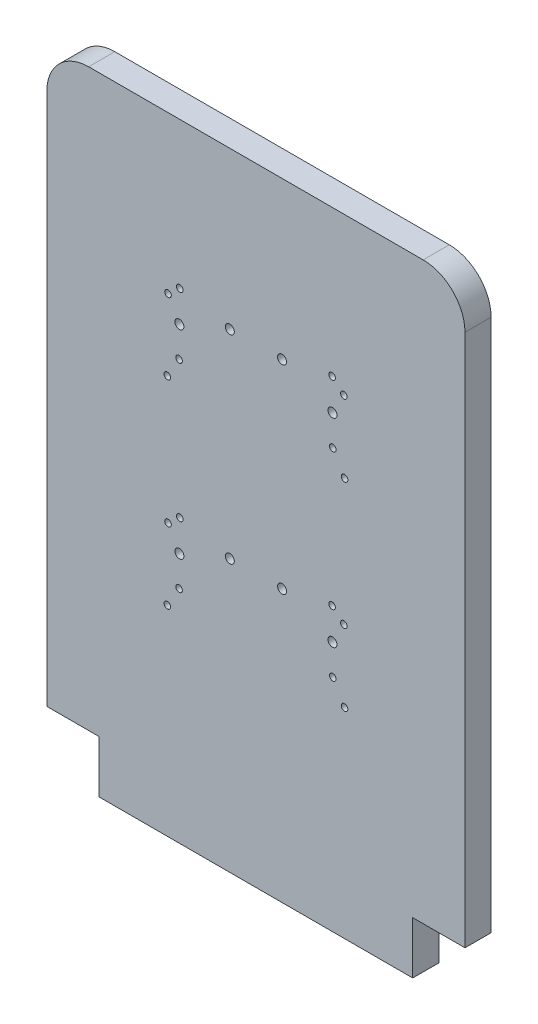
from build123d import *

# Parameters (mm, degrees)
SKETCH1_R           = 1.0922
SKETCH1_R_2         = 0.8
BOSS_EXTRUDE1_DEPTH = 6.35
FILLET1_R           = 10.16


with BuildPart() as part:
    # Sketch1 → Boss-Extrude1 (new body)
    with BuildSketch(Plane.XY):
        Polygon((88.9, 0), (101.6, 0), (101.6, 139.7), (0, 139.7), (0, 0), (12.7, 0), (12.7, -12.7), (88.9, -12.7), align=None)
        with Locations((44.45, 53.34)):
            Circle(SKETCH1_R, mode=Mode.SUBTRACT)
        with Locations((57.15, 53.34)):
            Circle(SKETCH1_R, mode=Mode.SUBTRACT)
        with Locations((32.3, 55.88)):
            Circle(SKETCH1_R_2, mode=Mode.SUBTRACT)
        with Locations((69.3, 55.88)):
            Circle(SKETCH1_R_2, mode=Mode.SUBTRACT)
        with Locations((32.125311619, 40.88)):
            Circle(SKETCH1_R_2, mode=Mode.SUBTRACT)
        with Locations((69.474688381, 40.88)):
            Circle(SKETCH1_R_2, mode=Mode.SUBTRACT)
        with Locations((32.3, 104.14)):
            Circle(SKETCH1_R_2, mode=Mode.SUBTRACT)
        with Locations((32.125311619, 89.14)):
            Circle(SKETCH1_R_2, mode=Mode.SUBTRACT)
        with Locations((69.474688381, 89.14)):
            Circle(SKETCH1_R_2, mode=Mode.SUBTRACT)
        with Locations((69.3, 104.14)):
            Circle(SKETCH1_R_2, mode=Mode.SUBTRACT)
        with Locations((44.45, 101.6)):
            Circle(SKETCH1_R, mode=Mode.SUBTRACT)
        with Locations((57.15, 101.6)):
            Circle(SKETCH1_R, mode=Mode.SUBTRACT)
        with Locations((29.4386, 53.34)):
            Circle(SKETCH1_R_2, mode=Mode.SUBTRACT)
        with Locations((29.263911619, 35.9540048)):
            Circle(SKETCH1_R_2, mode=Mode.SUBTRACT)
        with Locations((72.336088381, 35.9540048)):
            Circle(SKETCH1_R_2, mode=Mode.SUBTRACT)
        with Locations((72.1614, 53.34)):
            Circle(SKETCH1_R_2, mode=Mode.SUBTRACT)
        with Locations((29.4386, 101.6)):
            Circle(SKETCH1_R_2, mode=Mode.SUBTRACT)
        with Locations((29.263911619, 84.2140048)):
            Circle(SKETCH1_R_2, mode=Mode.SUBTRACT)
        with Locations((72.336088381, 84.2140048)):
            Circle(SKETCH1_R_2, mode=Mode.SUBTRACT)
        with Locations((72.1614, 101.6)):
            Circle(SKETCH1_R_2, mode=Mode.SUBTRACT)
        with Locations((32.2, 48.26)):
            Circle(SKETCH1_R, mode=Mode.SUBTRACT)
        with Locations((69.4, 48.26)):
            Circle(SKETCH1_R, mode=Mode.SUBTRACT)
        with Locations((32.2, 96.52)):
            Circle(SKETCH1_R, mode=Mode.SUBTRACT)
        with Locations((69.4, 96.52)):
            Circle(SKETCH1_R, mode=Mode.SUBTRACT)
    extrude(amount=BOSS_EXTRUDE1_DEPTH)

    # Fillet1
    fillet1_edges = [part.edges().sort_by_distance(p)[0] for p in [
        (101.6, 139.7, 3.175),
        (0, 139.7, 3.175),
    ]]
    fillet(fillet1_edges, radius=FILLET1_R)


solid = part.part
